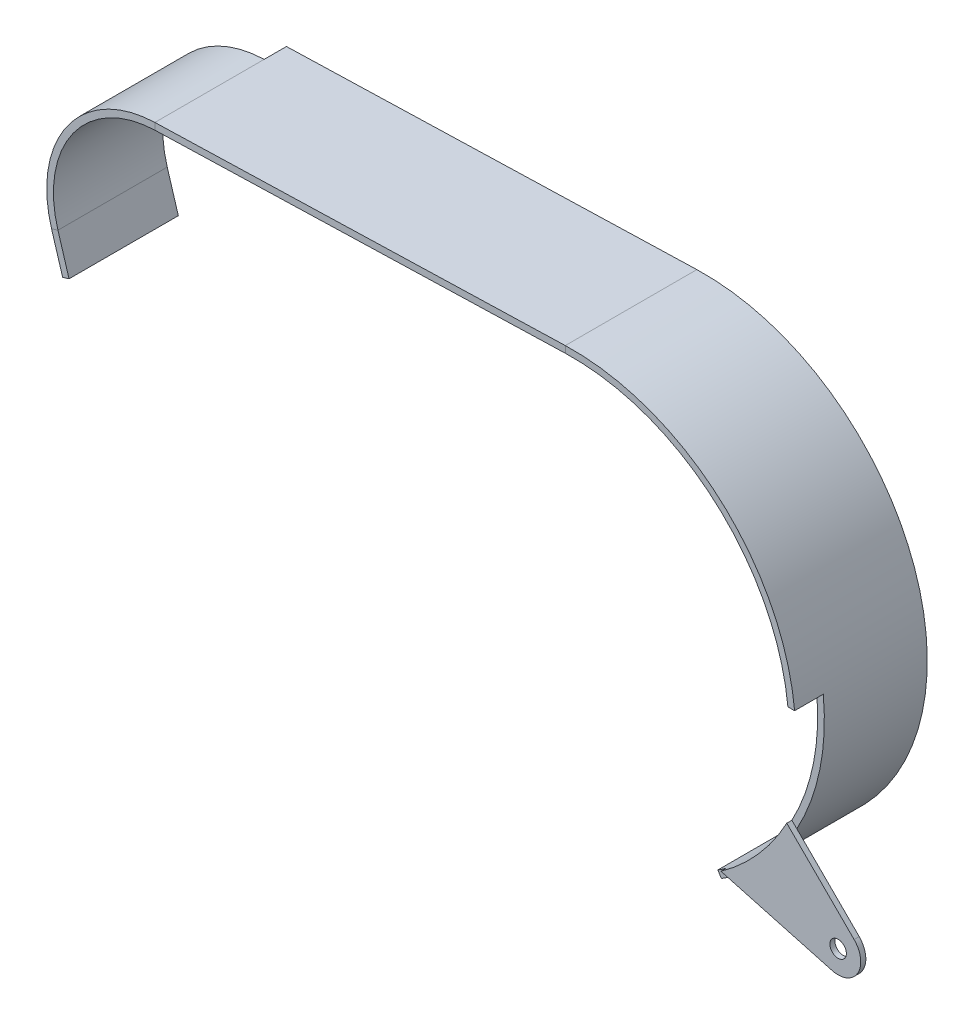
from build123d import *

# Parameters (mm, degrees)
BASE_FLANGE1_DEPTH  = 52.5018
CUT_EXTRUDE1_DEPTH  = 8.89
CUT_EXTRUDE2_START  = -11.43
CUT_EXTRUDE2_DEPTH  = 11.43
SKETCH10_R          = 3.302
BOSS_EXTRUDE2_DEPTH = 2.032


# Sheet-metal steps are written as plain solids
with BuildPart() as part:
    # Sketch2 → Base-Flange1 (new body)
    with BuildSketch(Plane.XY):
        with BuildLine():
            Line((-203.2, 12.573), (-207.631458356, 27.163090613))
            ThreePointArc((-207.631458356, 27.163090613), (-201.190368302, 66.028990192), (-166.399327165, 84.512205491))
            Line((-166.399327165, 84.512205491), (-2.61152029, 89.301967603))
            ThreePointArc((-2.61152029, 89.301967603), (85.351357983, 26.397104888), (48.26, -75.184))
            Line((48.26, -75.184), (46.819332757, -72.939592084))
            ThreePointArc((46.819332757, -72.939592084), (82.803432048, 25.609093195), (-2.533560661, 86.636107274))
            Line((-2.533560661, 86.636107274), (-166.321367535, 81.846345161))
            ThreePointArc((-166.321367535, 81.846345161), (-199.024946204, 64.47212278), (-205.079570854, 27.938177176))
            Line((-205.079570854, 27.938177176), (-200.648112499, 13.348086563))
            Line((-200.648112499, 13.348086563), (-203.2, 12.573))
        make_face()
    extrude(amount=BASE_FLANGE1_DEPTH)

    # Sketch7 → Cut-Extrude1 (cut)
    with BuildSketch(Plane(origin=(0, 0, 0), x_dir=(-1, 0, 0), z_dir=(0, 0, -1))):
        with BuildLine():
            Line((166.399327165, 84.512205491), (166.321367535, 81.846345161))
            ThreePointArc((166.321367535, 81.846345161), (199.024946204, 64.47212278), (205.079570854, 27.938177176))
            Line((205.079570854, 27.938177176), (200.648112499, 13.348086563))
            Line((200.648112499, 13.348086563), (203.2, 12.573))
            Line((203.2, 12.573), (207.631458356, 27.163090613))
            ThreePointArc((207.631458356, 27.163090613), (201.190368302, 66.028990192), (166.399327165, 84.512205491))
        make_face()
    extrude(amount=-CUT_EXTRUDE1_DEPTH, mode=Mode.SUBTRACT)

    # Sketch9 → Cut-Extrude2 (cut)
    with BuildSketch(Plane.XY.offset(52.5018).offset(CUT_EXTRUDE2_START)):
        with BuildLine():
            Line((46.819332757, -72.939592084), (48.26, -75.184))
            ThreePointArc((48.26, -75.184), (80.427121635, -38.89909461), (88.901213224, 8.845097132))
            Line((88.901213224, 8.845097132), (86.220637146, 8.845097132))
            ThreePointArc((86.220637146, 8.845097132), (78.083879549, -37.618370083), (46.819332757, -72.939592084))
        make_face()
    extrude(amount=CUT_EXTRUDE2_DEPTH, mode=Mode.SUBTRACT)

    # Sketch10 → Boss-Extrude2 (add)
    with BuildSketch(Plane.XY.offset(41.0718)):
        with BuildLine():
            Line((76.378066867, -40.971025307), (103.240982904, -67.736900681))
            ThreePointArc((103.240982904, -67.736900681), (104.68136366, -78.663063475), (94.486544869, -82.848920608))
            Line((94.486544869, -82.848920608), (50.096351047, -70.728987162))
            ThreePointArc((50.096351047, -70.728987162), (64.964056756, -57.375128261), (76.378066867, -40.971025307))
        make_face()
        with Locations((96.865618573, -74.135379129)):
            Circle(SKETCH10_R, mode=Mode.SUBTRACT)
    extrude(amount=BOSS_EXTRUDE2_DEPTH)


solid = part.part
